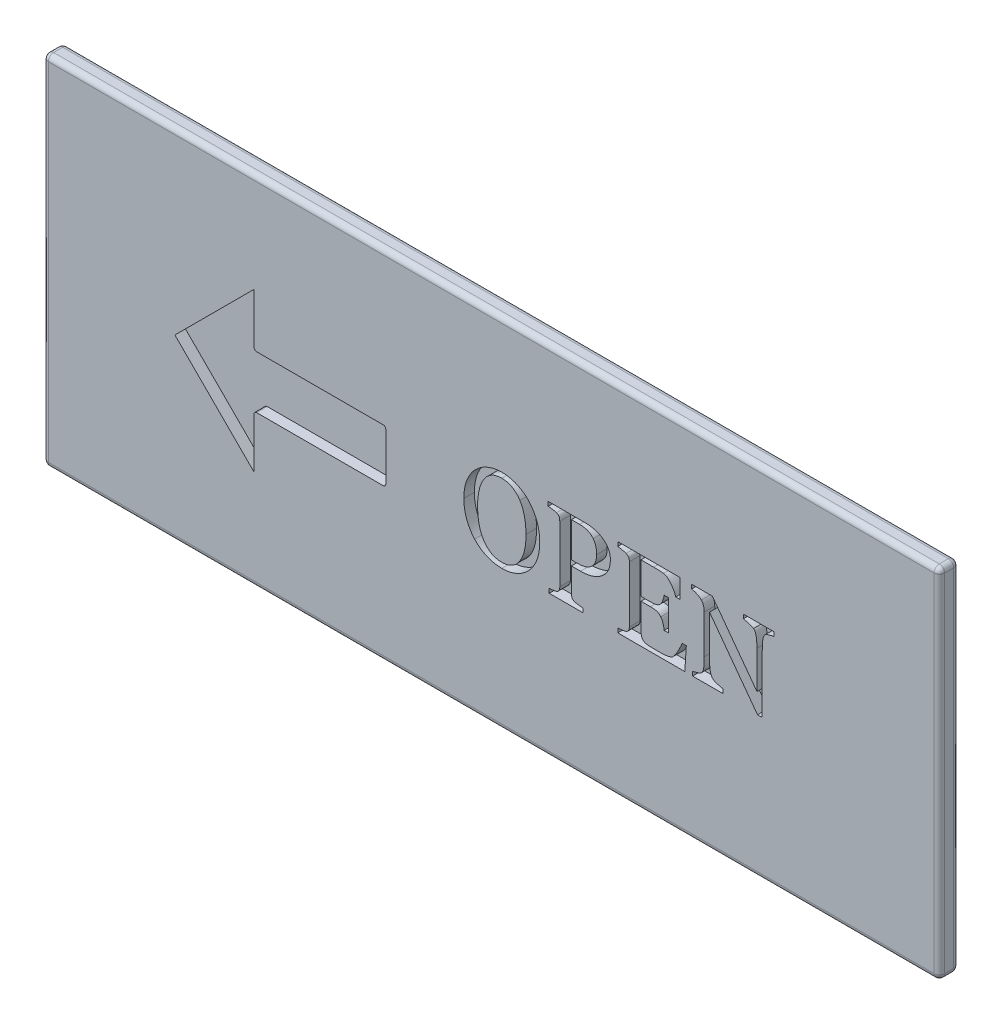
from build123d import *

# Parameters (mm, degrees)
SKETCH_1_W          = 170
SKETCH_1_H          = 67.8
EXTRUDE_1_DEPTH     = 3.7
FILLET_1_R          = 1
CUT_EXTRUDE_1_DEPTH = 2
CUT_EXTRUDE_2_DEPTH = 2
FILLET_2_R          = 0.5


with BuildPart() as part:
    # 草图1 → 凸台-拉伸1 (new body)
    with BuildSketch(Plane.XY):
        Rectangle(SKETCH_1_W, SKETCH_1_H)
    extrude(amount=EXTRUDE_1_DEPTH)

    # 圆角1
    fillet_1_edges = [part.edges().sort_by_distance(p)[0] for p in [
        (0, -33.9, 3.7),
        (0, -33.9, 0),
        (0, 33.9, 3.7),
        (0, 33.9, 0),
        (-85, 33.9, 1.85),
        (-85, 0, 3.7),
        (-85, -33.9, 1.85),
        (-85, 0, 0),
        (85, -33.9, 1.85),
        (85, 0, 3.7),
        (85, 33.9, 1.85),
        (85, 0, 0),
    ]]
    fillet(fillet_1_edges, radius=FILLET_1_R)

    # 草图2 → 切除-拉伸1 (cut)
    with BuildSketch(Plane.XY.offset(3.7)):
        Polygon((-60, 0), (-45, -15), (-45, -5), (-20, -5), (-20, 5), (-45, 5), (-45, 15), align=None)
    extrude(amount=-CUT_EXTRUDE_1_DEPTH, mode=Mode.SUBTRACT)

    # 草图3 → 切除-拉伸2 (cut)
    # profile 1 of 4: a face of its own
    with BuildSketch(Plane.XY.offset(3.7)):
        with BuildLine():
            add(Edge.make_bspline(
                [(7.0875, 6.322995952), (7.247802054, 6.143972036), (7.570546334, 5.783534079), (7.985393112, 5.176473471), (8.348938255, 4.518540047), (8.654773316, 3.808004275), (8.898603176, 3.051719067), (9.072404939, 2.253281088), (9.182035962, 1.416674265), (9.193939194, 0.845216787), (9.2, 0.554245952)],
                knots=[0, 0, 0, 0, 0.915570089, 1.843363841, 2.796351829, 3.778506709, 4.78850275, 5.821698104, 6.890867042, 8, 8, 8, 8], degree=3))
            add(Edge.make_bspline(
                [(9.2, 0.554245952), (9.194361311, 0.261141849), (9.183323162, -0.31263097), (9.068385611, -1.152033889), (8.894145388, -1.951497908), (8.642064503, -2.706120563), (8.330260957, -3.411926814), (7.963309196, -4.067537253), (7.538753547, -4.669078922), (7.210183372, -5.027155291), (7.046875, -5.205129048)],
                knots=[0, 0, 0, 0, 1.115004608, 2.182703448, 3.218717185, 4.225541562, 5.205422103, 6.15165086, 7.081319879, 8, 8, 8, 8], degree=3))
            add(Edge.make_bspline(
                [(7.046875, -5.205129048), (6.880452925, -5.369319078), (6.549412337, -5.695919763), (5.993910089, -6.117832478), (5.399841933, -6.482020039), (4.770289596, -6.788297325), (4.109075132, -7.02850664), (3.42621103, -7.204841894), (2.719993537, -7.310879127), (2.242027369, -7.323658146), (2, -7.330129048)],
                knots=[0, 0, 0, 0, 0.996249321, 1.981702003, 2.966914307, 3.964381325, 4.962263802, 5.962220984, 6.968131369, 8, 8, 8, 8], degree=3))
            add(Edge.make_bspline(
                [(2, -7.330129048), (1.744414728, -7.322822647), (1.240238292, -7.308409784), (0.499212025, -7.197143423), (-0.211504631, -7.011353655), (-0.890349114, -6.756663789), (-1.527604832, -6.428727527), (-2.124691449, -6.048233228), (-2.673744632, -5.605173329), (-2.999192866, -5.268046434), (-3.1625, -5.098879048)],
                knots=[0, 0, 0, 0, 1.058596254, 2.088223952, 3.096244063, 4.097367337, 5.085561236, 6.060014263, 7.026531786, 8, 8, 8, 8], degree=3))
            add(Edge.make_bspline(
                [(-3.1625, -5.098879048), (-3.316702685, -4.920871911), (-3.627504705, -4.562091015), (-4.022298861, -3.956321317), (-4.3748863, -3.302232553), (-4.668575814, -2.593954767), (-4.906768836, -1.846950429), (-5.073454648, -1.068188422), (-5.181096306, -0.265429658), (-5.193649815, 0.278898074), (-5.2, 0.554245952)],
                knots=[0, 0, 0, 0, 0.918904815, 1.852091434, 2.816806551, 3.817971808, 4.842200091, 5.87483003, 6.924983962, 8, 8, 8, 8], degree=3))
            add(Edge.make_bspline(
                [(-5.2, 0.554245952), (-5.194512006, 0.852578966), (-5.183803549, 1.434701693), (-5.068015244, 2.281979344), (-4.899703731, 3.082816128), (-4.644652234, 3.830220008), (-4.333008451, 4.529382479), (-3.961464406, 5.177060582), (-3.544046362, 5.782319924), (-3.218670383, 6.142968354), (-3.05625, 6.322995952)],
                knots=[0, 0, 0, 0, 1.133978211, 2.212676634, 3.247069858, 4.241878549, 5.210179397, 6.154215519, 7.078625832, 8, 8, 8, 8], degree=3))
            add(Edge.make_bspline(
                [(-3.05625, 6.322995952), (-2.887918569, 6.490504642), (-2.553577294, 6.823211782), (-1.990553089, 7.250787878), (-1.39211402, 7.622681299), (-0.754360437, 7.927816637), (-0.088969395, 8.167327727), (0.593664894, 8.343953645), (1.292488294, 8.450223568), (1.7631808, 8.463294555), (2, 8.469870952)],
                knots=[0, 0, 0, 0, 1.008630087, 2.003349393, 2.997595409, 3.999847191, 5.002861818, 5.999619617, 6.99354998, 8, 8, 8, 8], degree=3))
            add(Edge.make_bspline(
                [(2, 8.469870952), (2.245205943, 8.463730458), (2.730681388, 8.451573089), (3.446526261, 8.340319779), (4.141563364, 8.167016143), (4.809236226, 7.917944596), (5.447064414, 7.610684584), (6.042170448, 7.239905696), (6.595315781, 6.814571133), (6.923153106, 6.48713948), (7.0875, 6.322995952)],
                knots=[0, 0, 0, 0, 1.035965556, 2.051075242, 3.055015342, 4.059534728, 5.058051958, 6.042950296, 7.018918787, 8, 8, 8, 8], degree=3))
        make_face()
        with BuildLine():
            add(Edge.make_bspline(
                [(5.48125, -4.327004048), (5.574581233, -4.162800205), (5.762652217, -3.83191442), (5.998066915, -3.303425138), (6.186874545, -2.741637275), (6.33979429, -2.148140023), (6.458050619, -1.521727348), (6.541272638, -0.861143069), (6.59231686, -0.165317789), (6.597396394, 0.310405531), (6.6, 0.554245952)],
                knots=[0, 0, 0, 0, 0.893655072, 1.80079683, 2.733220172, 3.695918186, 4.699685548, 5.748531072, 6.84596969, 8, 8, 8, 8], degree=3))
            add(Edge.make_bspline(
                [(6.6, 0.554245952), (6.596549565, 0.805396966), (6.589782869, 1.297932726), (6.532285207, 2.020960564), (6.43966138, 2.712911589), (6.309258632, 3.370520932), (6.144408275, 3.989945957), (5.947473006, 4.565367403), (5.709302703, 5.092122501), (5.520453937, 5.415093905), (5.428125, 5.572995952)],
                knots=[0, 0, 0, 0, 1.155043419, 2.265171773, 3.333744221, 4.364526278, 5.346587502, 6.279979449, 7.159074886, 8, 8, 8, 8], degree=3))
            add(Edge.make_bspline(
                [(5.428125, 5.572995952), (5.329472966, 5.717299069), (5.13585014, 6.000520568), (4.788907132, 6.376431567), (4.40671406, 6.702230451), (3.989391306, 6.979851103), (3.537875914, 7.199800881), (3.053285159, 7.357141723), (2.537116512, 7.452943883), (2.181667564, 7.464145752), (2, 7.469870952)],
                knots=[0, 0, 0, 0, 1.023011571, 2.007849017, 2.986198337, 3.959452302, 4.936582685, 5.918902063, 6.936364857, 8, 8, 8, 8], degree=3))
            add(Edge.make_bspline(
                [(2, 7.469870952), (1.798520722, 7.462504196), (1.408226307, 7.448233727), (0.844521634, 7.342828884), (0.329903945, 7.156322794), (-0.136708469, 6.899883635), (-0.557387251, 6.583936818), (-0.937493541, 6.217471188), (-1.282024699, 5.805482458), (-1.470395371, 5.497463189), (-1.565625, 5.341745952)],
                knots=[0, 0, 0, 0, 1.106812517, 2.144055442, 3.136259835, 4.101942646, 5.05895253, 6.018372785, 6.998200614, 8, 8, 8, 8], degree=3))
            add(Edge.make_bspline(
                [(-1.565625, 5.341745952), (-1.649567729, 5.181566436), (-1.820739969, 4.854935566), (-2.031737171, 4.329545649), (-2.210151921, 3.765399416), (-2.350474266, 3.164029954), (-2.46315416, 2.537169866), (-2.538763817, 1.889999977), (-2.59235377, 1.22806214), (-2.597433701, 0.78039846), (-2.6, 0.554245952)],
                knots=[0, 0, 0, 0, 0.876691038, 1.787708964, 2.741651199, 3.744079983, 4.780747401, 5.829179856, 6.903336499, 8, 8, 8, 8], degree=3))
            add(Edge.make_bspline(
                [(-2.6, 0.554245952), (-2.597771732, 0.307254652), (-2.593422461, -0.174838091), (-2.537107711, -0.879721686), (-2.455191435, -1.548776827), (-2.337648367, -2.181931477), (-2.181224187, -2.778437284), (-1.987838052, -3.340212659), (-1.75497369, -3.868233176), (-1.565461361, -4.196263648), (-1.471875, -4.358254048)],
                knots=[0, 0, 0, 0, 1.161090735, 2.266287984, 3.322775518, 4.329531603, 5.291841248, 6.219691012, 7.120834829, 8, 8, 8, 8], degree=3))
            add(Edge.make_bspline(
                [(-1.471875, -4.358254048), (-1.375346267, -4.506622734), (-1.185310755, -4.79871524), (-0.843612127, -5.188193634), (-0.466576891, -5.527356077), (-0.055266676, -5.819419322), (0.399584227, -6.05116101), (0.897800994, -6.210573972), (1.435188665, -6.31574587), (1.807805813, -6.325234735), (2, -6.330129048)],
                knots=[0, 0, 0, 0, 1.012879785, 1.994050099, 2.957350163, 3.912503271, 4.875821815, 5.868320498, 6.900489659, 8, 8, 8, 8], degree=3))
            add(Edge.make_bspline(
                [(2, -6.330129048), (2.182708454, -6.323288811), (2.54035366, -6.309899295), (3.063557723, -6.211332429), (3.556669894, -6.043767599), (4.022290872, -5.8154931), (4.450958441, -5.523190157), (4.839546349, -5.176152455), (5.193640033, -4.781014514), (5.38431861, -4.480016358), (5.48125, -4.327004048)],
                knots=[0, 0, 0, 0, 1.041516606, 2.038731167, 3.022983239, 4.003194371, 4.986729267, 5.971303897, 6.968713028, 8, 8, 8, 8], degree=3))
        make_face(mode=Mode.SUBTRACT)
    # profile 2 of 4: a face of its own
    with BuildSketch(Plane.XY.offset(3.7)):
        with BuildLine():
            add(Edge.make_bspline(
                [(22.6, 4.376120952), (22.595533857, 4.186111355), (22.586816782, 3.815248162), (22.491431117, 3.27666648), (22.347047041, 2.76966151), (22.138998486, 2.298723596), (21.878416212, 1.866752321), (21.572430097, 1.472244987), (21.221443754, 1.115458648), (20.95572302, 0.912652721), (20.821875, 0.810495952)],
                knots=[0, 0, 0, 0, 1.098465555, 2.143999301, 3.155042162, 4.142924828, 5.113683058, 6.067466601, 7.026550302, 8, 8, 8, 8], degree=3))
            add(Edge.make_bspline(
                [(20.821875, 0.810495952), (20.682773765, 0.716380436), (20.405409425, 0.528716479), (19.961927833, 0.290942258), (19.49766464, 0.093020539), (19.012676495, -0.062204681), (18.510529319, -0.179385718), (17.995347041, -0.268551542), (17.463465682, -0.318019389), (17.104261744, -0.326050984), (16.921875, -0.330129048)],
                knots=[0, 0, 0, 0, 0.975396361, 1.944915652, 2.918507462, 3.904290212, 4.899670375, 5.912653754, 6.940144457, 8, 8, 8, 8], degree=3))
            Line((16.921875, -0.330129048), (15.2, -0.330129048))
            Line((15.2, -0.330129048), (15.2, -4.848879048))
            add(Edge.make_bspline(
                [(15.2, -4.848879048), (15.206073858, -4.963943567), (15.217715041, -5.184476751), (15.290952028, -5.449400681), (15.395166717, -5.633514827), (15.514269428, -5.745975641), (15.658148444, -5.848416308), (15.771715568, -5.89587509), (15.83125, -5.920754048)],
                knots=[0, 0, 0, 0, 1.543862581, 2.958974076, 3.642156683, 4.353773535, 5.137011175, 6, 6, 6, 6], degree=3))
            add(Edge.make_bspline(
                [(15.83125, -5.920754048), (15.868588903, -5.932808433), (15.955741549, -5.960944544), (16.10685741, -5.991903392), (16.294169277, -6.027442819), (16.586498373, -6.071266153), (16.959418835, -6.112270389), (17.258230625, -6.124382522), (17.4, -6.130129048)],
                knots=[0, 0, 0, 0, 0.44482582, 1.038266898, 1.747480273, 2.608172256, 4.390768659, 6, 6, 6, 6], degree=3))
            Line((17.4, -6.130129048), (17.4, -6.930129048))
            Line((17.4, -6.930129048), (11, -6.930129048))
            Line((11, -6.930129048), (11, -6.130129048))
            add(Edge.make_bspline(
                [(11, -6.130129048), (11.046872425, -6.125940384), (11.150010513, -6.116723649), (11.318975761, -6.102153114), (11.515394996, -6.077793068), (11.730520196, -6.059528651), (11.941750788, -6.034794491), (12.126312546, -5.997696942), (12.277756705, -5.968624786), (12.362805328, -5.935319562), (12.4, -5.920754048)],
                knots=[0, 0, 0, 0, 0.795657397, 1.750764587, 2.867138215, 4.141169139, 5.401615559, 6.458619135, 7.325901416, 8, 8, 8, 8], degree=3))
            add(Edge.make_bspline(
                [(12.4, -5.920754048), (12.449681006, -5.896027508), (12.545469806, -5.848352839), (12.674314181, -5.756794332), (12.777231005, -5.646034451), (12.861628167, -5.520834935), (12.922926571, -5.377269482), (12.97096323, -5.218293333), (12.994271245, -5.039130782), (12.998022451, -4.914553364), (13, -4.848879048)],
                knots=[0, 0, 0, 0, 1.014821994, 1.956654853, 2.873659688, 3.767181126, 4.705922198, 5.719310827, 6.797673726, 8, 8, 8, 8], degree=3))
            Line((13, -4.848879048), (13, 5.894870952))
            add(Edge.make_bspline(
                [(13, 5.894870952), (12.994586559, 6.011887384), (12.984182695, 6.236776325), (12.917279285, 6.509086578), (12.817578718, 6.700349298), (12.70150188, 6.823820076), (12.547170803, 6.92606619), (12.426104388, 6.973221876), (12.3625, 6.997995952)],
                knots=[0, 0, 0, 0, 1.524602288, 2.930068782, 3.610134201, 4.311129589, 5.112721982, 6, 6, 6, 6], degree=3))
            add(Edge.make_bspline(
                [(12.3625, 6.997995952), (12.222602977, 7.03965174), (11.945669094, 7.122111673), (11.531360554, 7.188650464), (11.150776098, 7.239212182), (10.910505185, 7.260212503), (10.8, 7.269870952)],
                knots=[0, 0, 0, 0, 1.100906273, 2.179304758, 3.162627464, 4, 4, 4, 4], degree=3))
            Line((10.8, 7.269870952), (10.8, 8.069870952))
            Line((10.8, 8.069870952), (17.796875, 8.069870952))
            add(Edge.make_bspline(
                [(17.796875, 8.069870952), (17.970950564, 8.067041746), (18.311424069, 8.061508118), (18.809390864, 8.013289859), (19.283236191, 7.937411265), (19.729709614, 7.82350115), (20.153224492, 7.683842345), (20.548815205, 7.50828657), (20.92221906, 7.304110984), (21.26649333, 7.068338993), (21.578255143, 6.806586406), (21.854882797, 6.525020618), (22.082845423, 6.216155707), (22.271874084, 5.889263247), (22.422035092, 5.541816062), (22.522651667, 5.171266758), (22.587655519, 4.780478869), (22.595825946, 4.512846968), (22.6, 4.376120952)],
                knots=[0, 0, 0, 0, 1.229806495, 2.405372242, 3.531985389, 4.617424463, 5.657905945, 6.67957503, 7.671210598, 8.661424544, 9.62273649, 10.544132624, 11.44362871, 12.327416774, 13.207918856, 14.109821142, 15.034357925, 16, 16, 16, 16], degree=3))
        make_face()
        with BuildLine():
            add(Edge.make_bspline(
                [(19.38125, 1.901120952), (19.440191876, 1.98547645), (19.555494953, 2.150494076), (19.697061087, 2.410830787), (19.804387912, 2.676625304), (19.903655404, 3.02535705), (19.976714374, 3.441828383), (19.992577165, 3.769612593), (20, 3.922995952)],
                knots=[0, 0, 0, 0, 0.860828494, 1.683966991, 2.4740288, 3.254848671, 4.715433748, 6, 6, 6, 6], degree=3))
            add(Edge.make_bspline(
                [(20, 3.922995952), (19.992440946, 4.125523534), (19.97713197, 4.535692579), (19.881691391, 5.043203043), (19.76750614, 5.440949719), (19.657895404, 5.726362853), (19.51093104, 5.988624766), (19.395304995, 6.149046315), (19.3375, 6.229245952)],
                knots=[0, 0, 0, 0, 1.492720518, 3.02313267, 3.791108453, 4.542666051, 5.271434201, 6, 6, 6, 6], degree=3))
            add(Edge.make_bspline(
                [(19.3375, 6.229245952), (19.271211586, 6.309786773), (19.13806274, 6.471563419), (18.891342837, 6.672242357), (18.621883225, 6.853404325), (18.317931667, 7.002979758), (17.9818284, 7.127720583), (17.606092157, 7.207799813), (17.194406515, 7.263958107), (16.906468335, 7.267843782), (16.75625, 7.269870952)],
                knots=[0, 0, 0, 0, 0.865658491, 1.738786953, 2.632776412, 3.562782529, 4.549583467, 5.606904605, 6.751513934, 8, 8, 8, 8], degree=3))
            Line((16.75625, 7.269870952), (15.2, 7.269870952))
            Line((15.2, 7.269870952), (15.2, 0.669870952))
            Line((15.2, 0.669870952), (16.325, 0.669870952))
            add(Edge.make_bspline(
                [(16.325, 0.669870952), (16.514770482, 0.673737359), (16.87681178, 0.681113631), (17.392602478, 0.745267571), (17.851976343, 0.856816802), (18.256784506, 1.010431172), (18.60811424, 1.19958849), (18.912578851, 1.409511427), (19.176900927, 1.636784797), (19.314127039, 1.814293911), (19.38125, 1.901120952)],
                knots=[0, 0, 0, 0, 1.330956645, 2.539179261, 3.638035866, 4.639596241, 5.568085981, 6.429570918, 7.231838258, 8, 8, 8, 8], degree=3))
        make_face(mode=Mode.SUBTRACT)
    # profile 3 of 4: a face of its own
    with BuildSketch(Plane.XY.offset(3.7)):
        with BuildLine():
            Line((37, -2.530129048), (36.709375, -6.930129048))
            Line((36.709375, -6.930129048), (24, -6.930129048))
            Line((24, -6.930129048), (24, -6.130129048))
            add(Edge.make_bspline(
                [(24, -6.130129048), (24.05943142, -6.126584414), (24.186860158, -6.118984257), (24.39034954, -6.092989199), (24.62233908, -6.075049877), (24.867856135, -6.042940015), (25.105162217, -6.01305523), (25.304508283, -5.974128775), (25.459782035, -5.943874241), (25.542964478, -5.912247435), (25.578125, -5.898879048)],
                knots=[0, 0, 0, 0, 0.893501195, 1.915783407, 3.078087283, 4.385344551, 5.632585547, 6.666166666, 7.436199806, 8, 8, 8, 8], degree=3))
            add(Edge.make_bspline(
                [(25.578125, -5.898879048), (25.633241316, -5.872421459), (25.738222702, -5.822027047), (25.87364607, -5.723953249), (25.983480139, -5.616125129), (26.067272514, -5.49401163), (26.126234463, -5.355378996), (26.17014918, -5.202247311), (26.194400917, -5.030883445), (26.198075048, -4.91145173), (26.2, -4.848879048)],
                knots=[0, 0, 0, 0, 1.120399477, 2.134052117, 3.053505915, 3.933954351, 4.832897305, 5.807375152, 6.851239651, 8, 8, 8, 8], degree=3))
            Line((26.2, -4.848879048), (26.2, 5.854245952))
            add(Edge.make_bspline(
                [(26.2, 5.854245952), (26.194131554, 5.963182227), (26.182844975, 6.172695565), (26.106486436, 6.423470642), (26.006430554, 6.601688505), (25.89361709, 6.717481749), (25.74851192, 6.818992174), (25.637377851, 6.872560284), (25.578125, 6.901120952)],
                knots=[0, 0, 0, 0, 1.50091987, 2.886666823, 3.569149328, 4.300811714, 5.09405144, 6, 6, 6, 6], degree=3))
            add(Edge.make_bspline(
                [(25.578125, 6.901120952), (25.525275495, 6.923710021), (25.412731653, 6.971813795), (25.226532723, 7.033280119), (25.01605209, 7.09237785), (24.78805475, 7.142329476), (24.561894233, 7.187828989), (24.352456002, 7.225057754), (24.168365162, 7.255390427), (24.053201639, 7.265295257), (24, 7.269870952)],
                knots=[0, 0, 0, 0, 0.847814813, 1.805434832, 2.890745262, 4.072866596, 5.248574203, 6.294865337, 7.212285652, 8, 8, 8, 8], degree=3))
            Line((24, 7.269870952), (24, 8.069870952))
            Line((24, 8.069870952), (35.8, 8.069870952))
            Line((35.8, 8.069870952), (35.8, 4.469870952))
            Line((35.8, 4.469870952), (35, 4.469870952))
            add(Edge.make_bspline(
                [(35, 4.469870952), (34.956325523, 4.608582102), (34.865862893, 4.895893509), (34.659321282, 5.322172517), (34.388972531, 5.75717302), (34.121244391, 6.118264786), (33.891801206, 6.40140724), (33.712561871, 6.588767892), (33.537761745, 6.752171245), (33.365470505, 6.89177933), (33.193453238, 7.004278055), (33.024837897, 7.093526554), (32.856537507, 7.155484664), (32.743101706, 7.175624304), (32.6875, 7.185495952)],
                knots=[0, 0, 0, 0, 1.410249005, 2.921038609, 4.582525326, 6.376528199, 7.281559129, 8.118434423, 8.891210355, 9.603459239, 10.268180082, 10.883283338, 11.452630021, 12, 12, 12, 12], degree=3))
            add(Edge.make_bspline(
                [(32.6875, 7.185495952), (32.564681308, 7.199166478), (32.297690526, 7.228884304), (31.8637286, 7.250104211), (31.364712471, 7.266401131), (31.010436599, 7.268665665), (30.821875, 7.269870952)],
                knots=[0, 0, 0, 0, 0.793463735, 1.724879974, 2.789078504, 4, 4, 4, 4], degree=3))
            Line((30.821875, 7.269870952), (28.4, 7.269870952))
            Line((28.4, 7.269870952), (28.4, 1.269870952))
            Line((28.4, 1.269870952), (30.190625, 1.269870952))
            add(Edge.make_bspline(
                [(30.190625, 1.269870952), (30.325055726, 1.271376826), (30.574469256, 1.27417072), (30.919170297, 1.301202656), (31.206273643, 1.345635615), (31.444297109, 1.411411783), (31.64605011, 1.503623765), (31.82977937, 1.616791328), (31.998521672, 1.758462492), (32.099072702, 1.867679494), (32.15, 1.922995952)],
                knots=[0, 0, 0, 0, 1.50408809, 2.790581675, 3.865632119, 4.751061767, 5.544042853, 6.339760723, 7.159118501, 8, 8, 8, 8], degree=3))
            add(Edge.make_bspline(
                [(32.15, 1.922995952), (32.190795427, 1.976340302), (32.275589646, 2.087217744), (32.383458345, 2.276983083), (32.483839416, 2.49011655), (32.599509413, 2.802203788), (32.724395978, 3.194152255), (32.775533528, 3.515922024), (32.8, 3.669870952)],
                knots=[0, 0, 0, 0, 0.641110518, 1.332562757, 2.080664854, 2.890402061, 4.512230431, 6, 6, 6, 6], degree=3))
            Line((32.8, 3.669870952), (33.6, 3.669870952))
            Line((33.6, 3.669870952), (33.6, -2.130129048))
            Line((33.6, -2.130129048), (32.8, -2.130129048))
            add(Edge.make_bspline(
                [(32.8, -2.130129048), (32.777668118, -1.952113704), (32.731167324, -1.581439407), (32.595110051, -1.131012071), (32.466319321, -0.781502254), (32.367183902, -0.55203503), (32.26675124, -0.361258042), (32.186709032, -0.256361704), (32.15, -0.208254048)],
                knots=[0, 0, 0, 0, 1.572834493, 3.275050949, 4.11425844, 4.843216821, 5.469475017, 6, 6, 6, 6], degree=3))
            add(Edge.make_bspline(
                [(32.15, -0.208254048), (32.092462753, -0.142845632), (31.980032846, -0.015035169), (31.784945823, 0.140511923), (31.579650283, 0.263263332), (31.35632165, 0.345012055), (31.111066415, 0.399302791), (30.836977335, 0.44508211), (30.525219041, 0.463005216), (30.306249763, 0.467498378), (30.190625, 0.469870952)],
                knots=[0, 0, 0, 0, 0.968434944, 1.892357669, 2.765745811, 3.621075858, 4.527056629, 5.560684743, 6.711941462, 8, 8, 8, 8], degree=3))
            Line((30.190625, 0.469870952), (28.4, 0.469870952))
            Line((28.4, 0.469870952), (28.4, -4.117629048))
            add(Edge.make_bspline(
                [(28.4, -4.117629048), (28.400951677, -4.226004051), (28.402755983, -4.431474846), (28.422552285, -4.721221781), (28.448034588, -4.976421513), (28.490530323, -5.197929166), (28.552739503, -5.390123511), (28.637633638, -5.55514475), (28.745110755, -5.696969275), (28.833888098, -5.771243775), (28.878125, -5.808254048)],
                knots=[0, 0, 0, 0, 1.427935166, 2.707256876, 3.826035847, 4.805998598, 5.67420874, 6.478534097, 7.241868087, 8, 8, 8, 8], degree=3))
            add(Edge.make_bspline(
                [(28.878125, -5.808254048), (28.928081282, -5.841622137), (29.032288787, -5.911227104), (29.217552874, -5.976889826), (29.421538489, -6.0408264), (29.659629418, -6.07451855), (29.9350209, -6.098460279), (30.258160996, -6.116537812), (30.632183057, -6.129530604), (30.898943568, -6.129921458), (31.040625, -6.130129048)],
                knots=[0, 0, 0, 0, 0.648151527, 1.352027254, 2.115987591, 2.961698523, 3.947300163, 5.111229513, 6.465720668, 8, 8, 8, 8], degree=3))
            add(Edge.make_bspline(
                [(31.040625, -6.130129048), (31.10520836, -6.130127748), (31.243750085, -6.13012496), (31.465624582, -6.130149232), (31.715626868, -6.130038848), (31.9854146, -6.130508322), (32.258429964, -6.12874797), (32.517761657, -6.118040148), (32.75449526, -6.107676493), (32.904208837, -6.093216411), (32.975, -6.086379048)],
                knots=[0, 0, 0, 0, 0.800737276, 1.717710607, 2.750919995, 3.900365439, 5.062797748, 6.135452477, 7.118359941, 8, 8, 8, 8], degree=3))
            add(Edge.make_bspline(
                [(32.975, -6.086379048), (33.114859333, -6.068446635), (33.400657346, -6.03180233), (33.752425745, -5.957128369), (34.021686462, -5.876003336), (34.195931175, -5.806980536), (34.338951048, -5.725192762), (34.414457529, -5.658430455), (34.45, -5.627004048)],
                knots=[0, 0, 0, 0, 1.618673689, 3.307707206, 4.121076931, 4.845127875, 5.456377663, 6, 6, 6, 6], degree=3))
            add(Edge.make_bspline(
                [(34.45, -5.627004048), (34.536121155, -5.531571609), (34.720713239, -5.327021719), (34.978309899, -4.966874276), (35.237767716, -4.539926964), (35.498017268, -4.072151211), (35.736825687, -3.606265021), (35.936166049, -3.18668397), (36.095252391, -2.839400949), (36.168063185, -2.624423892), (36.2, -2.530129048)],
                knots=[0, 0, 0, 0, 0.862139392, 1.847909578, 2.965352454, 4.214006867, 5.439572447, 6.477666908, 7.332262879, 8, 8, 8, 8], degree=3))
            Line((36.2, -2.530129048), (37, -2.530129048))
        make_face()
    # profile 4 of 4: a face of its own
    with BuildSketch(Plane.XY.offset(3.7)):
        with BuildLine():
            add(Edge.make_bspline(
                [(53.6, 7.269870952), (53.548812315, 7.266839884), (53.434112452, 7.260047954), (53.246290823, 7.220150385), (53.021177366, 7.172860673), (52.774820606, 7.102048762), (52.529173514, 7.025830892), (52.31112669, 6.944956285), (52.129505875, 6.867316059), (52.029536633, 6.802346358), (51.984375, 6.772995952)],
                knots=[0, 0, 0, 0, 0.721636794, 1.617022543, 2.699651884, 3.963875089, 5.226563525, 6.322642193, 7.242244757, 8, 8, 8, 8], degree=3))
            add(Edge.make_bspline(
                [(51.984375, 6.772995952), (51.92794266, 6.721479945), (51.807314665, 6.611360949), (51.685210304, 6.373852347), (51.581521358, 6.08768817), (51.511543273, 5.740877879), (51.459613823, 5.341976213), (51.42934987, 4.889955271), (51.400988421, 4.388969481), (51.400338983, 4.037631571), (51.4, 3.854245952)],
                knots=[0, 0, 0, 0, 0.597115289, 1.276374863, 2.069944957, 2.992955396, 4.051532198, 5.23550416, 6.557033648, 8, 8, 8, 8], degree=3))
            Line((51.4, 3.854245952), (51.4, -7.130129048))
            Line((51.4, -7.130129048), (50.503125, -7.130129048))
            Line((50.503125, -7.130129048), (41.4, 5.185495952))
            Line((41.4, 5.185495952), (41.4, -2.511379048))
            add(Edge.make_bspline(
                [(41.4, -2.511379048), (41.401231838, -2.714555404), (41.403545621, -3.096185076), (41.434919527, -3.631101836), (41.482675814, -4.091473391), (41.549513792, -4.481770212), (41.639375152, -4.81041234), (41.753182378, -5.084095345), (41.878787435, -5.316376636), (41.993200209, -5.434219901), (42.046875, -5.489504048)],
                knots=[0, 0, 0, 0, 1.564392426, 2.938425413, 4.124561296, 5.126873188, 5.985219305, 6.740483808, 7.409119581, 8, 8, 8, 8], degree=3))
            add(Edge.make_bspline(
                [(42.046875, -5.489504048), (42.095698539, -5.52880756), (42.206754804, -5.618209135), (42.425461682, -5.722063853), (42.701257724, -5.827786986), (43.019966439, -5.922589273), (43.338842499, -6.004076724), (43.614587999, -6.069792931), (43.827870923, -6.115105495), (43.949883235, -6.12575482), (44, -6.130129048)],
                knots=[0, 0, 0, 0, 0.72261565, 1.64369474, 2.779885142, 4.139958371, 5.483669464, 6.584983551, 7.418779589, 8, 8, 8, 8], degree=3))
            Line((44, -6.130129048), (44, -6.930129048))
            Line((44, -6.930129048), (38.2, -6.930129048))
            Line((38.2, -6.930129048), (38.2, -6.130129048))
            add(Edge.make_bspline(
                [(38.2, -6.130129048), (38.250108023, -6.123467326), (38.365654177, -6.108105788), (38.55919373, -6.064898927), (38.797126648, -6.005817884), (39.061954894, -5.928884572), (39.320802292, -5.844131793), (39.54022054, -5.762248156), (39.704470982, -5.683536787), (39.787093897, -5.621759806), (39.821875, -5.595754048)],
                knots=[0, 0, 0, 0, 0.705029105, 1.625755647, 2.76436342, 4.125947264, 5.472632914, 6.563097854, 7.395118884, 8, 8, 8, 8], degree=3))
            add(Edge.make_bspline(
                [(39.821875, -5.595754048), (39.875468515, -5.542594565), (39.986364156, -5.432597023), (40.108578268, -5.219334975), (40.208294996, -4.973360031), (40.270934397, -4.739807332), (40.304113349, -4.525094762), (40.335474237, -4.335153206), (40.349930942, -4.116551546), (40.371548729, -3.873147468), (40.380725774, -3.600933268), (40.396927027, -3.303214672), (40.396138872, -2.97802254), (40.398681569, -2.753037566), (40.4, -2.636379048)],
                knots=[0, 0, 0, 0, 0.875884541, 1.812379285, 2.835440708, 3.965725206, 4.61806958, 5.366297751, 6.206749643, 7.168149523, 8.212859411, 9.378798593, 10.640862697, 12, 12, 12, 12], degree=3))
            Line((40.4, -2.636379048), (40.4, 4.697995952))
            add(Edge.make_bspline(
                [(40.4, 4.697995952), (40.392747444, 4.86010185), (40.378116933, 5.187116492), (40.279979151, 5.585074703), (40.175006343, 5.886589148), (40.080864477, 6.089265983), (39.974009314, 6.264787792), (39.887796343, 6.363596154), (39.846875, 6.410495952)],
                knots=[0, 0, 0, 0, 1.587732995, 3.202918242, 3.994333894, 4.716204477, 5.390641143, 6, 6, 6, 6], degree=3))
            add(Edge.make_bspline(
                [(39.846875, 6.410495952), (39.786646049, 6.467185376), (39.662766404, 6.583784879), (39.445854734, 6.735879267), (39.202853432, 6.881157383), (38.934289674, 7.002108986), (38.669315617, 7.108302024), (38.422734708, 7.192124359), (38.203188675, 7.247557057), (38.063762032, 7.262868695), (38, 7.269870952)],
                knots=[0, 0, 0, 0, 0.958113034, 1.970658632, 3.064610846, 4.237432849, 5.381531405, 6.374795584, 7.256768056, 8, 8, 8, 8], degree=3))
            Line((38, 7.269870952), (38, 8.069870952))
            Line((38, 8.069870952), (41.940625, 8.069870952))
            Line((41.940625, 8.069870952), (50.4, -3.377004048))
            Line((50.4, -3.377004048), (50.4, 3.732370952))
            add(Edge.make_bspline(
                [(50.4, 3.732370952), (50.398658236, 3.93762255), (50.396136341, 4.323400415), (50.36609845, 4.863730401), (50.314578025, 5.328303511), (50.243670668, 5.720095018), (50.156104224, 6.047754115), (50.043008052, 6.311243085), (49.919592261, 6.52504843), (49.807800829, 6.624164954), (49.75625, 6.669870952)],
                knots=[0, 0, 0, 0, 1.597899814, 3.003310992, 4.211516956, 5.234338353, 6.102170457, 6.84335817, 7.466633144, 8, 8, 8, 8], degree=3))
            add(Edge.make_bspline(
                [(49.75625, 6.669870952), (49.700738775, 6.704590875), (49.578330552, 6.781152039), (49.358989817, 6.873928224), (49.097691341, 6.971067303), (48.803292584, 7.058613228), (48.507240247, 7.139217975), (48.237173839, 7.207165131), (48.005124993, 7.248621696), (47.863631058, 7.2632793), (47.8, 7.269870952)],
                knots=[0, 0, 0, 0, 0.761894269, 1.680058823, 2.7668661, 4.010876332, 5.256425229, 6.342757932, 7.254723768, 8, 8, 8, 8], degree=3))
            Line((47.8, 7.269870952), (47.8, 8.069870952))
            Line((47.8, 8.069870952), (53.6, 8.069870952))
            Line((53.6, 8.069870952), (53.6, 7.269870952))
        make_face()
    extrude(amount=-CUT_EXTRUDE_2_DEPTH, mode=Mode.SUBTRACT)

    # 圆角2
    fillet_2_edges = [part.edges().sort_by_distance(p)[0] for p in [
        (-20, -5, 2.7),
        (-20, 5, 2.7),
        (-45, -5, 2.7),
        (-45, 5, 2.7),
    ]]
    fillet(fillet_2_edges, radius=FILLET_2_R)


solid = part.part
